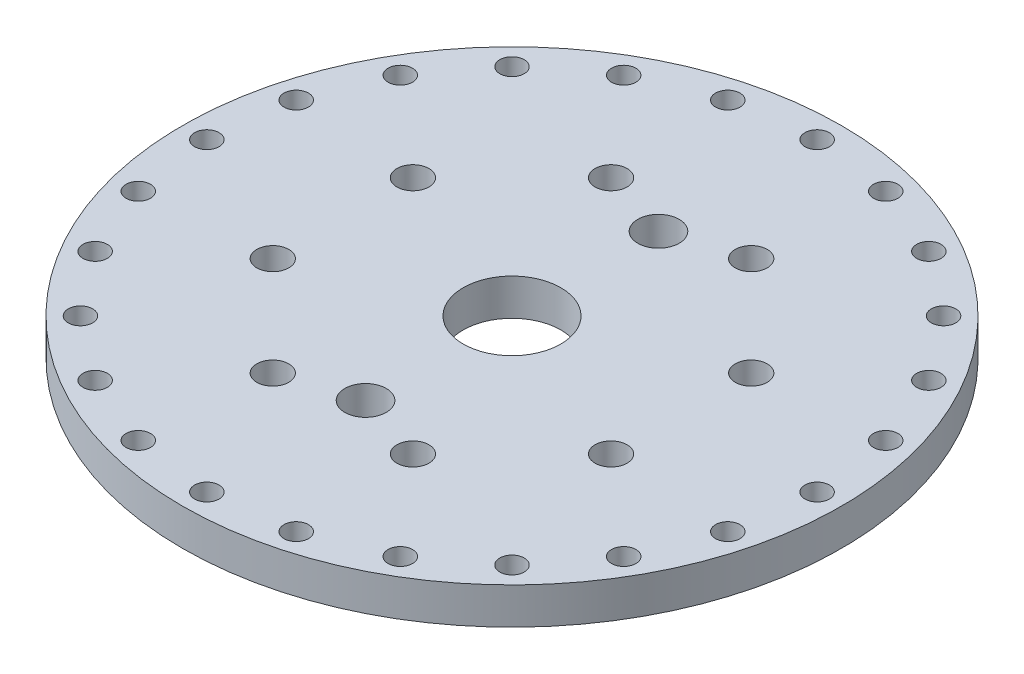
from build123d import *

# Parameters (mm, degrees)
SKETCH8_R           = 27
BOSS_EXTRUDE1_DEPTH = 3
CUT_EXTRUDE1_REACH  = 109.975
SKETCH6_R           = 4
CUT_EXTRUDE2_REACH  = 109.975
SKETCH7_R           = 1.7
CUT_EXTRUDE3_REACH  = 109.975
SKETCH9_R           = 1
CUT_EXTRUDE4_REACH  = 109.975
SKETCH11_R          = 1.3125


with BuildPart() as part:
    # Sketch8 → Boss-Extrude1 (new body)
    with BuildSketch(Plane(origin=(0, 0, 0), x_dir=(1, 0, 0), z_dir=(0, 1, 0))):
        with Locations((49.061012395, 49.578499829)):
            Circle(SKETCH8_R)
    extrude(amount=BOSS_EXTRUDE1_DEPTH)

    # Sketch6 → Cut-Extrude1 (cut, up to next)
    with BuildSketch(Plane(origin=(0, 0, 0), x_dir=(1, 0, 0), z_dir=(0, 1, 0)), mode=Mode.PRIVATE) as cut_extrude1_sk1:
        with Locations((49.061012163, 49.578499597)):
            Circle(SKETCH6_R)
    cut_extrude1_tool1 = extrude(cut_extrude1_sk1.sketch, amount=CUT_EXTRUDE1_REACH, mode=Mode.PRIVATE) & part.part
    add(cut_extrude1_tool1.solids().sort_by_distance((49.061012, 0, -49.5785))[0], mode=Mode.SUBTRACT)

    # Sketch7 → Cut-Extrude2 (cut, up to next)
    with BuildSketch(Plane(origin=(0, 0, 0), x_dir=(1, 0, 0), z_dir=(0, 1, 0)), mode=Mode.PRIVATE) as cut_extrude2_sk1:
        with Locations((49.061012163, 61.578499829)):
            Circle(SKETCH7_R)
    cut_extrude2_tool1 = extrude(cut_extrude2_sk1.sketch, amount=CUT_EXTRUDE2_REACH, mode=Mode.PRIVATE) & part.part
    # Sketch7 → Cut-Extrude2 (cut, up to next)
    with BuildSketch(Plane(origin=(0, 0, 0), x_dir=(1, 0, 0), z_dir=(0, 1, 0)), mode=Mode.PRIVATE) as cut_extrude2_sk2:
        with Locations((49.061012163, 37.578499829)):
            Circle(SKETCH7_R)
    cut_extrude2_tool2 = extrude(cut_extrude2_sk2.sketch, amount=CUT_EXTRUDE2_REACH, mode=Mode.PRIVATE) & part.part
    add(cut_extrude2_tool1.solids().sort_by_distance((49.061012, 0, -61.5785))[0], mode=Mode.SUBTRACT)
    add(cut_extrude2_tool2.solids().sort_by_distance((49.061012, 0, -37.5785))[0], mode=Mode.SUBTRACT)

    # Sketch9 → Cut-Extrude3 (cut, up to next)
    with BuildSketch(Plane(origin=(0, 0, 0), x_dir=(1, 0, 0), z_dir=(0, 1, 0)), mode=Mode.PRIVATE) as cut_extrude3_sk1:
        with Locations((49.061012163, 74.578499829)):
            Circle(SKETCH9_R)
    cut_extrude3_tool1 = extrude(cut_extrude3_sk1.sketch, amount=CUT_EXTRUDE3_REACH, mode=Mode.PRIVATE) & part.part
    # Sketch9 → Cut-Extrude3 (cut, up to next)
    with BuildSketch(Plane(origin=(0, 0, 0), x_dir=(1, 0, 0), z_dir=(0, 1, 0)), mode=Mode.PRIVATE) as cut_extrude3_sk2:
        with Locations((55.531488291, 73.726645486)):
            Circle(SKETCH9_R)
    cut_extrude3_tool2 = extrude(cut_extrude3_sk2.sketch, amount=CUT_EXTRUDE3_REACH, mode=Mode.PRIVATE) & part.part
    # Sketch9 → Cut-Extrude3 (cut, up to next)
    with BuildSketch(Plane(origin=(0, 0, 0), x_dir=(1, 0, 0), z_dir=(0, 1, 0)), mode=Mode.PRIVATE) as cut_extrude3_sk3:
        with Locations((61.561012163, 71.229134924)):
            Circle(SKETCH9_R)
    cut_extrude3_tool3 = extrude(cut_extrude3_sk3.sketch, amount=CUT_EXTRUDE3_REACH, mode=Mode.PRIVATE) & part.part
    # Sketch9 → Cut-Extrude3 (cut, up to next)
    with BuildSketch(Plane(origin=(0, 0, 0), x_dir=(1, 0, 0), z_dir=(0, 1, 0)), mode=Mode.PRIVATE) as cut_extrude3_sk4:
        with Locations((66.738681693, 67.256169359)):
            Circle(SKETCH9_R)
    cut_extrude3_tool4 = extrude(cut_extrude3_sk4.sketch, amount=CUT_EXTRUDE3_REACH, mode=Mode.PRIVATE) & part.part
    # Sketch9 → Cut-Extrude3 (cut, up to next)
    with BuildSketch(Plane(origin=(0, 0, 0), x_dir=(1, 0, 0), z_dir=(0, 1, 0)), mode=Mode.PRIVATE) as cut_extrude3_sk5:
        with Locations((70.711647258, 62.078499829)):
            Circle(SKETCH9_R)
    cut_extrude3_tool5 = extrude(cut_extrude3_sk5.sketch, amount=CUT_EXTRUDE3_REACH, mode=Mode.PRIVATE) & part.part
    # Sketch9 → Cut-Extrude3 (cut, up to next)
    with BuildSketch(Plane(origin=(0, 0, 0), x_dir=(1, 0, 0), z_dir=(0, 1, 0)), mode=Mode.PRIVATE) as cut_extrude3_sk6:
        with Locations((73.20915782, 56.048975957)):
            Circle(SKETCH9_R)
    cut_extrude3_tool6 = extrude(cut_extrude3_sk6.sketch, amount=CUT_EXTRUDE3_REACH, mode=Mode.PRIVATE) & part.part
    # Sketch9 → Cut-Extrude3 (cut, up to next)
    with BuildSketch(Plane(origin=(0, 0, 0), x_dir=(1, 0, 0), z_dir=(0, 1, 0)), mode=Mode.PRIVATE) as cut_extrude3_sk7:
        with Locations((74.061012163, 49.578499829)):
            Circle(SKETCH9_R)
    cut_extrude3_tool7 = extrude(cut_extrude3_sk7.sketch, amount=CUT_EXTRUDE3_REACH, mode=Mode.PRIVATE) & part.part
    # Sketch9 → Cut-Extrude3 (cut, up to next)
    with BuildSketch(Plane(origin=(0, 0, 0), x_dir=(1, 0, 0), z_dir=(0, 1, 0)), mode=Mode.PRIVATE) as cut_extrude3_sk8:
        with Locations((73.20915782, 43.108023702)):
            Circle(SKETCH9_R)
    cut_extrude3_tool8 = extrude(cut_extrude3_sk8.sketch, amount=CUT_EXTRUDE3_REACH, mode=Mode.PRIVATE) & part.part
    # Sketch9 → Cut-Extrude3 (cut, up to next)
    with BuildSketch(Plane(origin=(0, 0, 0), x_dir=(1, 0, 0), z_dir=(0, 1, 0)), mode=Mode.PRIVATE) as cut_extrude3_sk9:
        with Locations((70.711647258, 37.078499829)):
            Circle(SKETCH9_R)
    cut_extrude3_tool9 = extrude(cut_extrude3_sk9.sketch, amount=CUT_EXTRUDE3_REACH, mode=Mode.PRIVATE) & part.part
    # Sketch9 → Cut-Extrude3 (cut, up to next)
    with BuildSketch(Plane(origin=(0, 0, 0), x_dir=(1, 0, 0), z_dir=(0, 1, 0)), mode=Mode.PRIVATE) as cut_extrude3_sk10:
        with Locations((66.738681693, 31.9008303)):
            Circle(SKETCH9_R)
    cut_extrude3_tool10 = extrude(cut_extrude3_sk10.sketch, amount=CUT_EXTRUDE3_REACH, mode=Mode.PRIVATE) & part.part
    # Sketch9 → Cut-Extrude3 (cut, up to next)
    with BuildSketch(Plane(origin=(0, 0, 0), x_dir=(1, 0, 0), z_dir=(0, 1, 0)), mode=Mode.PRIVATE) as cut_extrude3_sk11:
        with Locations((61.561012163, 27.927864735)):
            Circle(SKETCH9_R)
    cut_extrude3_tool11 = extrude(cut_extrude3_sk11.sketch, amount=CUT_EXTRUDE3_REACH, mode=Mode.PRIVATE) & part.part
    # Sketch9 → Cut-Extrude3 (cut, up to next)
    with BuildSketch(Plane(origin=(0, 0, 0), x_dir=(1, 0, 0), z_dir=(0, 1, 0)), mode=Mode.PRIVATE) as cut_extrude3_sk12:
        with Locations((55.531488291, 25.430354172)):
            Circle(SKETCH9_R)
    cut_extrude3_tool12 = extrude(cut_extrude3_sk12.sketch, amount=CUT_EXTRUDE3_REACH, mode=Mode.PRIVATE) & part.part
    # Sketch9 → Cut-Extrude3 (cut, up to next)
    with BuildSketch(Plane(origin=(0, 0, 0), x_dir=(1, 0, 0), z_dir=(0, 1, 0)), mode=Mode.PRIVATE) as cut_extrude3_sk13:
        with Locations((49.061012163, 24.578499829)):
            Circle(SKETCH9_R)
    cut_extrude3_tool13 = extrude(cut_extrude3_sk13.sketch, amount=CUT_EXTRUDE3_REACH, mode=Mode.PRIVATE) & part.part
    # Sketch9 → Cut-Extrude3 (cut, up to next)
    with BuildSketch(Plane(origin=(0, 0, 0), x_dir=(1, 0, 0), z_dir=(0, 1, 0)), mode=Mode.PRIVATE) as cut_extrude3_sk14:
        with Locations((42.590536036, 25.430354172)):
            Circle(SKETCH9_R)
    cut_extrude3_tool14 = extrude(cut_extrude3_sk14.sketch, amount=CUT_EXTRUDE3_REACH, mode=Mode.PRIVATE) & part.part
    # Sketch9 → Cut-Extrude3 (cut, up to next)
    with BuildSketch(Plane(origin=(0, 0, 0), x_dir=(1, 0, 0), z_dir=(0, 1, 0)), mode=Mode.PRIVATE) as cut_extrude3_sk15:
        with Locations((36.561012163, 27.927864735)):
            Circle(SKETCH9_R)
    cut_extrude3_tool15 = extrude(cut_extrude3_sk15.sketch, amount=CUT_EXTRUDE3_REACH, mode=Mode.PRIVATE) & part.part
    # Sketch9 → Cut-Extrude3 (cut, up to next)
    with BuildSketch(Plane(origin=(0, 0, 0), x_dir=(1, 0, 0), z_dir=(0, 1, 0)), mode=Mode.PRIVATE) as cut_extrude3_sk16:
        with Locations((31.383342634, 31.9008303)):
            Circle(SKETCH9_R)
    cut_extrude3_tool16 = extrude(cut_extrude3_sk16.sketch, amount=CUT_EXTRUDE3_REACH, mode=Mode.PRIVATE) & part.part
    # Sketch9 → Cut-Extrude3 (cut, up to next)
    with BuildSketch(Plane(origin=(0, 0, 0), x_dir=(1, 0, 0), z_dir=(0, 1, 0)), mode=Mode.PRIVATE) as cut_extrude3_sk17:
        with Locations((27.410377069, 37.078499829)):
            Circle(SKETCH9_R)
    cut_extrude3_tool17 = extrude(cut_extrude3_sk17.sketch, amount=CUT_EXTRUDE3_REACH, mode=Mode.PRIVATE) & part.part
    # Sketch9 → Cut-Extrude3 (cut, up to next)
    with BuildSketch(Plane(origin=(0, 0, 0), x_dir=(1, 0, 0), z_dir=(0, 1, 0)), mode=Mode.PRIVATE) as cut_extrude3_sk18:
        with Locations((24.912866506, 43.108023702)):
            Circle(SKETCH9_R)
    cut_extrude3_tool18 = extrude(cut_extrude3_sk18.sketch, amount=CUT_EXTRUDE3_REACH, mode=Mode.PRIVATE) & part.part
    # Sketch9 → Cut-Extrude3 (cut, up to next)
    with BuildSketch(Plane(origin=(0, 0, 0), x_dir=(1, 0, 0), z_dir=(0, 1, 0)), mode=Mode.PRIVATE) as cut_extrude3_sk19:
        with Locations((24.061012163, 49.578499829)):
            Circle(SKETCH9_R)
    cut_extrude3_tool19 = extrude(cut_extrude3_sk19.sketch, amount=CUT_EXTRUDE3_REACH, mode=Mode.PRIVATE) & part.part
    # Sketch9 → Cut-Extrude3 (cut, up to next)
    with BuildSketch(Plane(origin=(0, 0, 0), x_dir=(1, 0, 0), z_dir=(0, 1, 0)), mode=Mode.PRIVATE) as cut_extrude3_sk20:
        with Locations((24.912866506, 56.048975957)):
            Circle(SKETCH9_R)
    cut_extrude3_tool20 = extrude(cut_extrude3_sk20.sketch, amount=CUT_EXTRUDE3_REACH, mode=Mode.PRIVATE) & part.part
    # Sketch9 → Cut-Extrude3 (cut, up to next)
    with BuildSketch(Plane(origin=(0, 0, 0), x_dir=(1, 0, 0), z_dir=(0, 1, 0)), mode=Mode.PRIVATE) as cut_extrude3_sk21:
        with Locations((27.410377069, 62.078499829)):
            Circle(SKETCH9_R)
    cut_extrude3_tool21 = extrude(cut_extrude3_sk21.sketch, amount=CUT_EXTRUDE3_REACH, mode=Mode.PRIVATE) & part.part
    # Sketch9 → Cut-Extrude3 (cut, up to next)
    with BuildSketch(Plane(origin=(0, 0, 0), x_dir=(1, 0, 0), z_dir=(0, 1, 0)), mode=Mode.PRIVATE) as cut_extrude3_sk22:
        with Locations((31.383342634, 67.256169359)):
            Circle(SKETCH9_R)
    cut_extrude3_tool22 = extrude(cut_extrude3_sk22.sketch, amount=CUT_EXTRUDE3_REACH, mode=Mode.PRIVATE) & part.part
    # Sketch9 → Cut-Extrude3 (cut, up to next)
    with BuildSketch(Plane(origin=(0, 0, 0), x_dir=(1, 0, 0), z_dir=(0, 1, 0)), mode=Mode.PRIVATE) as cut_extrude3_sk23:
        with Locations((36.561012163, 71.229134924)):
            Circle(SKETCH9_R)
    cut_extrude3_tool23 = extrude(cut_extrude3_sk23.sketch, amount=CUT_EXTRUDE3_REACH, mode=Mode.PRIVATE) & part.part
    # Sketch9 → Cut-Extrude3 (cut, up to next)
    with BuildSketch(Plane(origin=(0, 0, 0), x_dir=(1, 0, 0), z_dir=(0, 1, 0)), mode=Mode.PRIVATE) as cut_extrude3_sk24:
        with Locations((42.590536036, 73.726645486)):
            Circle(SKETCH9_R)
    cut_extrude3_tool24 = extrude(cut_extrude3_sk24.sketch, amount=CUT_EXTRUDE3_REACH, mode=Mode.PRIVATE) & part.part
    add(cut_extrude3_tool1.solids().sort_by_distance((49.061012, 0, -74.5785))[0], mode=Mode.SUBTRACT)
    add(cut_extrude3_tool2.solids().sort_by_distance((55.531488, 0, -73.726645))[0], mode=Mode.SUBTRACT)
    add(cut_extrude3_tool3.solids().sort_by_distance((61.561012, 0, -71.229135))[0], mode=Mode.SUBTRACT)
    add(cut_extrude3_tool4.solids().sort_by_distance((66.738682, 0, -67.256169))[0], mode=Mode.SUBTRACT)
    add(cut_extrude3_tool5.solids().sort_by_distance((70.711647, 0, -62.0785))[0], mode=Mode.SUBTRACT)
    add(cut_extrude3_tool6.solids().sort_by_distance((73.209158, 0, -56.048976))[0], mode=Mode.SUBTRACT)
    add(cut_extrude3_tool7.solids().sort_by_distance((74.061012, 0, -49.5785))[0], mode=Mode.SUBTRACT)
    add(cut_extrude3_tool8.solids().sort_by_distance((73.209158, 0, -43.108024))[0], mode=Mode.SUBTRACT)
    add(cut_extrude3_tool9.solids().sort_by_distance((70.711647, 0, -37.0785))[0], mode=Mode.SUBTRACT)
    add(cut_extrude3_tool10.solids().sort_by_distance((66.738682, 0, -31.90083))[0], mode=Mode.SUBTRACT)
    add(cut_extrude3_tool11.solids().sort_by_distance((61.561012, 0, -27.927865))[0], mode=Mode.SUBTRACT)
    add(cut_extrude3_tool12.solids().sort_by_distance((55.531488, 0, -25.430354))[0], mode=Mode.SUBTRACT)
    add(cut_extrude3_tool13.solids().sort_by_distance((49.061012, 0, -24.5785))[0], mode=Mode.SUBTRACT)
    add(cut_extrude3_tool14.solids().sort_by_distance((42.590536, 0, -25.430354))[0], mode=Mode.SUBTRACT)
    add(cut_extrude3_tool15.solids().sort_by_distance((36.561012, 0, -27.927865))[0], mode=Mode.SUBTRACT)
    add(cut_extrude3_tool16.solids().sort_by_distance((31.383343, 0, -31.90083))[0], mode=Mode.SUBTRACT)
    add(cut_extrude3_tool17.solids().sort_by_distance((27.410377, 0, -37.0785))[0], mode=Mode.SUBTRACT)
    add(cut_extrude3_tool18.solids().sort_by_distance((24.912867, 0, -43.108024))[0], mode=Mode.SUBTRACT)
    add(cut_extrude3_tool19.solids().sort_by_distance((24.061012, 0, -49.5785))[0], mode=Mode.SUBTRACT)
    add(cut_extrude3_tool20.solids().sort_by_distance((24.912867, 0, -56.048976))[0], mode=Mode.SUBTRACT)
    add(cut_extrude3_tool21.solids().sort_by_distance((27.410377, 0, -62.0785))[0], mode=Mode.SUBTRACT)
    add(cut_extrude3_tool22.solids().sort_by_distance((31.383343, 0, -67.256169))[0], mode=Mode.SUBTRACT)
    add(cut_extrude3_tool23.solids().sort_by_distance((36.561012, 0, -71.229135))[0], mode=Mode.SUBTRACT)
    add(cut_extrude3_tool24.solids().sort_by_distance((42.590536, 0, -73.726645))[0], mode=Mode.SUBTRACT)

    # Sketch11 → Cut-Extrude4 (cut, up to next)
    with BuildSketch(Plane(origin=(0, 0, 0), x_dir=(1, 0, 0), z_dir=(0, 1, 0)), mode=Mode.PRIVATE) as cut_extrude4_sk1:
        with Locations((54.801263765, 63.436692537)):
            Circle(SKETCH11_R)
    cut_extrude4_tool1 = extrude(cut_extrude4_sk1.sketch, amount=CUT_EXTRUDE4_REACH, mode=Mode.PRIVATE) & part.part
    # Sketch11 → Cut-Extrude4 (cut, up to next)
    with BuildSketch(Plane(origin=(0, 0, 0), x_dir=(1, 0, 0), z_dir=(0, 1, 0)), mode=Mode.PRIVATE) as cut_extrude4_sk2:
        with Locations((62.919205199, 55.318750967)):
            Circle(SKETCH11_R)
    cut_extrude4_tool2 = extrude(cut_extrude4_sk2.sketch, amount=CUT_EXTRUDE4_REACH, mode=Mode.PRIVATE) & part.part
    # Sketch11 → Cut-Extrude4 (cut, up to next)
    with BuildSketch(Plane(origin=(0, 0, 0), x_dir=(1, 0, 0), z_dir=(0, 1, 0)), mode=Mode.PRIVATE) as cut_extrude4_sk3:
        with Locations((62.919205103, 43.838247996)):
            Circle(SKETCH11_R)
    cut_extrude4_tool3 = extrude(cut_extrude4_sk3.sketch, amount=CUT_EXTRUDE4_REACH, mode=Mode.PRIVATE) & part.part
    # Sketch11 → Cut-Extrude4 (cut, up to next)
    with BuildSketch(Plane(origin=(0, 0, 0), x_dir=(1, 0, 0), z_dir=(0, 1, 0)), mode=Mode.PRIVATE) as cut_extrude4_sk4:
        with Locations((54.801263533, 35.720306562)):
            Circle(SKETCH11_R)
    cut_extrude4_tool4 = extrude(cut_extrude4_sk4.sketch, amount=CUT_EXTRUDE4_REACH, mode=Mode.PRIVATE) & part.part
    # Sketch11 → Cut-Extrude4 (cut, up to next)
    with BuildSketch(Plane(origin=(0, 0, 0), x_dir=(1, 0, 0), z_dir=(0, 1, 0)), mode=Mode.PRIVATE) as cut_extrude4_sk5:
        with Locations((43.320760562, 35.720306658)):
            Circle(SKETCH11_R)
    cut_extrude4_tool5 = extrude(cut_extrude4_sk5.sketch, amount=CUT_EXTRUDE4_REACH, mode=Mode.PRIVATE) & part.part
    # Sketch11 → Cut-Extrude4 (cut, up to next)
    with BuildSketch(Plane(origin=(0, 0, 0), x_dir=(1, 0, 0), z_dir=(0, 1, 0)), mode=Mode.PRIVATE) as cut_extrude4_sk6:
        with Locations((35.202819127, 43.838248228)):
            Circle(SKETCH11_R)
    cut_extrude4_tool6 = extrude(cut_extrude4_sk6.sketch, amount=CUT_EXTRUDE4_REACH, mode=Mode.PRIVATE) & part.part
    # Sketch11 → Cut-Extrude4 (cut, up to next)
    with BuildSketch(Plane(origin=(0, 0, 0), x_dir=(1, 0, 0), z_dir=(0, 1, 0)), mode=Mode.PRIVATE) as cut_extrude4_sk7:
        with Locations((35.202819224, 55.318751199)):
            Circle(SKETCH11_R)
    cut_extrude4_tool7 = extrude(cut_extrude4_sk7.sketch, amount=CUT_EXTRUDE4_REACH, mode=Mode.PRIVATE) & part.part
    # Sketch11 → Cut-Extrude4 (cut, up to next)
    with BuildSketch(Plane(origin=(0, 0, 0), x_dir=(1, 0, 0), z_dir=(0, 1, 0)), mode=Mode.PRIVATE) as cut_extrude4_sk8:
        with Locations((43.320760794, 63.436692633)):
            Circle(SKETCH11_R)
    cut_extrude4_tool8 = extrude(cut_extrude4_sk8.sketch, amount=CUT_EXTRUDE4_REACH, mode=Mode.PRIVATE) & part.part
    add(cut_extrude4_tool1.solids().sort_by_distance((54.801264, 0, -63.436693))[0], mode=Mode.SUBTRACT)
    add(cut_extrude4_tool2.solids().sort_by_distance((62.919205, 0, -55.318751))[0], mode=Mode.SUBTRACT)
    add(cut_extrude4_tool3.solids().sort_by_distance((62.919205, 0, -43.838248))[0], mode=Mode.SUBTRACT)
    add(cut_extrude4_tool4.solids().sort_by_distance((54.801264, 0, -35.720307))[0], mode=Mode.SUBTRACT)
    add(cut_extrude4_tool5.solids().sort_by_distance((43.320761, 0, -35.720307))[0], mode=Mode.SUBTRACT)
    add(cut_extrude4_tool6.solids().sort_by_distance((35.202819, 0, -43.838248))[0], mode=Mode.SUBTRACT)
    add(cut_extrude4_tool7.solids().sort_by_distance((35.202819, 0, -55.318751))[0], mode=Mode.SUBTRACT)
    add(cut_extrude4_tool8.solids().sort_by_distance((43.320761, 0, -63.436693))[0], mode=Mode.SUBTRACT)


solid = part.part
